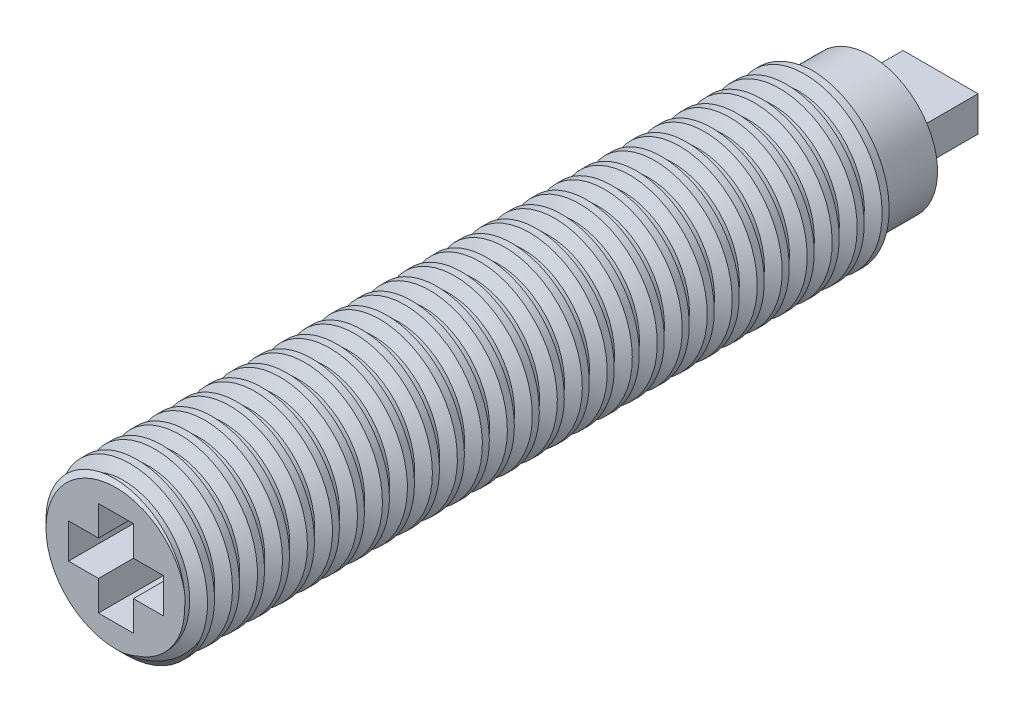
from build123d import *

# Parameters (mm, degrees)
SKETCH1_R           = 8
BOSS_EXTRUDE1_DEPTH = 75.5
CHAMFER1_SIZE       = 1
CUT_SWEEP2_PITCH    = 2.5
SKETCH5_W           = 1.3
SKETCH5_H           = 5.5
SKETCH6_W           = 7.5
SKETCH6_H           = 3.5
BOSS_EXTRUDE2_DEPTH = 7
CUT_EXTRUDE1_DEPTH  = 1.5
SKETCH8_W           = 3.5
SKETCH8_H           = 3
SKETCH8_H_2         = 3.5
SKETCH8_W_2         = 3
CUT_EXTRUDE2_DEPTH  = 11


with BuildPart() as part:
    # Sketch1 → Boss-Extrude1 (new body)
    with BuildSketch(Plane.XY):
        Circle(SKETCH1_R)
    extrude(amount=BOSS_EXTRUDE1_DEPTH)

    # Chamfer1
    chamfer1_edges = [part.edges().sort_by_distance(p)[0] for p in [
        (-8, 0, 75.5),
    ]]
    chamfer(chamfer1_edges, length=CHAMFER1_SIZE)

    # Cut-Sweep2: the profile of Sketch4 screwed along a left-hand helix of 29 turns, 10 arcs to a turn; built about Z, then put on its axis
    cut_sweep2_z = Axis((0, 0, 0), (0, 0, 1))
    cut_sweep2_corners = [(8.170091408, 0, 0), (8.170091408, 0, -2), (6.870091408, 0, -1.24944465), (6.870091408, 0, -0.75055535)]
    with BuildLine(mode=Mode.PRIVATE) as cut_sweep2_profile:
        Line(cut_sweep2_corners[0], cut_sweep2_corners[1])
        Line(cut_sweep2_corners[1], cut_sweep2_corners[2])
        Line(cut_sweep2_corners[2], cut_sweep2_corners[3])
        Line(cut_sweep2_corners[3], cut_sweep2_corners[0])
    cut_sweep2_cap = Face(cut_sweep2_profile.wire())
    cut_sweep2_turn_angles = [0, -18, -36, -54, -72, -90, -108, -126, -144, -162, -180, -198, -216, -234, -252, -270, -288, -306, -324, -342, -360]
    cut_sweep2_turn_weights = [1, 0.9510565162951535, 1, 0.9510565162951535, 1, 0.9510565162951535, 1, 0.9510565162951535, 1, 0.9510565162951535, 1, 0.9510565162951535, 1, 0.9510565162951535, 1, 0.9510565162951535, 1, 0.9510565162951535, 1, 0.9510565162951535, 1]
    cut_sweep2_turn_rails = [Edge.make_bspline([Vector(p[0], p[1], 0).rotate(cut_sweep2_z, cut_sweep2_turn_angles[k]) / cut_sweep2_turn_weights[k] + Vector(0, 0, p[2] + -CUT_SWEEP2_PITCH * cut_sweep2_turn_angles[k] / 360) for k in range(21)], [0, 0, 0, 1, 1, 2, 2, 3, 3, 4, 4, 5, 5, 6, 6, 7, 7, 8, 8, 9, 9, 10, 10, 10], 2, cut_sweep2_turn_weights) for p in cut_sweep2_corners]
    cut_sweep2_turn_sides = [Face.make_surface_from_curves(cut_sweep2_turn_rails[p[0]], cut_sweep2_turn_rails[p[1]]) for p in [(0, 1), (1, 2), (2, 3), (3, 0)]]
    cut_sweep2 = Plane(origin=(0, 0, 75.5), x_dir=(-1, 0, 0), z_dir=(0, 0, -1)) * Solid(Shell([*[p.moved(Location((0, 0, CUT_SWEEP2_PITCH * i))) for i in range(29) for p in cut_sweep2_turn_sides], cut_sweep2_cap, cut_sweep2_cap.rotate(cut_sweep2_z, -10440).moved(Location((0, 0, -CUT_SWEEP2_PITCH * -10440 / 360)))]))
    add(cut_sweep2, mode=Mode.SUBTRACT)

    # Cut-Sweep3: sweep along a curve in space
    with BuildLine() as cut_sweep3_path:
        ThreePointArc((8, 0, 0), (5.656854249, 5.656854249, 0), (0, 8, 0))
        ThreePointArc((0, 8, 0), (-5.656854249, 5.656854249, 0), (-8, 0, 0))
        ThreePointArc((-8, 0, 0), (-5.656854249, -5.656854249, 0), (0, -8, 0))
        ThreePointArc((0, -8, 0), (5.656854249, -5.656854249, 0), (8, 0, 0))
    # Sketch5 → Cut-Sweep3 (sweep, cut)
    with BuildSketch(Plane(origin=(0, 0, 0), x_dir=(1, 0, 0), z_dir=(0, 1, 0))):
        with Locations((7.35, -2.75)):
            Rectangle(SKETCH5_W, SKETCH5_H)
    sweep(path=cut_sweep3_path.line, mode=Mode.SUBTRACT)

    # Sketch6 → Boss-Extrude2 (add)
    with BuildSketch(Plane.XY):
        Rectangle(SKETCH6_W, SKETCH6_H)
    extrude(amount=-BOSS_EXTRUDE2_DEPTH)

    # Sketch7 → Cut-Extrude1 (cut)
    with BuildSketch(Plane.XY):
        with BuildLine():
            Line((1.997706693, 4.551919587), (2.326733136, 4.237416382))
            add(Edge.make_bspline(
                [(2.326733136, 4.237416382), (2.354643839, 4.266276096), (2.409162187, 4.322648159), (2.497011762, 4.397279802), (2.588372121, 4.459475179), (2.681466031, 4.51185573), (2.777967982, 4.551485349), (2.876762148, 4.58036412), (2.978479359, 4.597970416), (3.047317655, 4.599984888), (3.081941469, 4.600998113)],
                knots=[0, 0, 0, 0, 1.115251505, 2.178435587, 3.19620269, 4.182487026, 5.141301733, 6.088180966, 7.038406374, 8, 8, 8, 8], degree=3))
            add(Edge.make_bspline(
                [(3.081941469, 4.600998113), (3.110856561, 4.600197629), (3.16791731, 4.598617964), (3.251697442, 4.587037456), (3.331837468, 4.5673443), (3.408611721, 4.540203482), (3.481794288, 4.505084705), (3.551538605, 4.462015148), (3.617672722, 4.411383792), (3.679323045, 4.353452606), (3.735718594, 4.290158431), (3.785547652, 4.222623698), (3.827287481, 4.151003124), (3.86154268, 4.076022031), (3.888226156, 3.997333368), (3.90728151, 3.914990111), (3.918302618, 3.828894197), (3.919947592, 3.770366837), (3.920783616, 3.74062151)],
                knots=[0, 0, 0, 0, 1.035432265, 2.043311493, 3.022114605, 3.98653278, 4.95457646, 5.923598177, 6.917315552, 7.932509744, 8.948865224, 9.949768934, 10.933144597, 11.912367597, 12.897413939, 13.903909035, 14.934704909, 16, 16, 16, 16], degree=3))
            add(Edge.make_bspline(
                [(3.920783616, 3.74062151), (3.920542684, 3.719744159), (3.9200678, 3.67859447), (3.914869364, 3.617722661), (3.906498655, 3.558662614), (3.894384165, 3.501503792), (3.879234877, 3.446196658), (3.861461313, 3.392264083), (3.839164637, 3.340451292), (3.814414991, 3.290156513), (3.785631438, 3.242752102), (3.754597458, 3.197548063), (3.720946173, 3.15476598), (3.684459623, 3.114580748), (3.644624304, 3.077620372), (3.602469811, 3.04277341), (3.557285058, 3.010912199), (3.510008646, 2.981237147), (3.460232166, 2.955458177), (3.40930617, 2.932107411), (3.356458516, 2.913143117), (3.302332658, 2.897856165), (3.247122021, 2.884856897), (3.190286594, 2.876852847), (3.13231907, 2.870791474), (3.093142753, 2.87041722), (3.073427847, 2.870228882)],
                knots=[0, 0, 0, 0, 1.103660481, 2.175337485, 3.227646561, 4.255952547, 5.262355991, 6.258840057, 7.255597736, 8.242457506, 9.22035537, 10.185017736, 11.140346927, 12.096287581, 13.051739095, 14.01125915, 14.986044842, 15.97314143, 16.960198552, 17.947847494, 18.933482797, 19.925264591, 20.920966487, 21.929612487, 22.958107872, 24, 24, 24, 24], degree=3))
            add(Edge.make_bspline(
                [(3.073427847, 2.870228882), (3.039987978, 2.87119614), (2.97428733, 2.873096552), (2.877862183, 2.8879575), (2.785978625, 2.912402918), (2.712564101, 2.941271536), (2.655045761, 2.969779672), (2.611257899, 2.996148294), (2.565977837, 3.025644492), (2.519957637, 3.059381486), (2.472679665, 3.096954417), (2.424978485, 3.139186203), (2.375632939, 3.184686213), (2.343307161, 3.217160463), (2.326733136, 3.233810613)],
                knots=[0, 0, 0, 0, 1.404581149, 2.759636711, 4.088442092, 5.392261763, 6.066678138, 6.783632037, 7.538459478, 8.336747902, 9.180226004, 10.074962426, 11.012997595, 12, 12, 12, 12], degree=3))
            Line((2.326733136, 3.233810613), (2.007722719, 2.898774555))
            add(Edge.make_bspline(
                [(2.007722719, 2.898774555), (2.030147434, 2.877124197), (2.073915682, 2.834867327), (2.13993887, 2.774866515), (2.205878965, 2.720949115), (2.270142992, 2.671158163), (2.333783662, 2.626944189), (2.396794227, 2.588263037), (2.45846138, 2.554136403), (2.520065658, 2.525139818), (2.581990396, 2.500518705), (2.645703674, 2.479321544), (2.711400269, 2.461389507), (2.779481427, 2.446920709), (2.849312129, 2.435318686), (2.921545895, 2.427487388), (2.99572473, 2.422222666), (3.046041383, 2.421749587), (3.071424642, 2.421510933)],
                knots=[0, 0, 0, 0, 1.244526981, 2.429050516, 3.560637417, 4.644440555, 5.67424972, 6.652764056, 7.595344123, 8.486817594, 9.369275933, 10.254498637, 11.166417451, 12.086725134, 13.032340136, 13.991389299, 14.986715468, 16, 16, 16, 16], degree=3))
            add(Edge.make_bspline(
                [(3.071424642, 2.421510933), (3.118050545, 2.42269952), (3.209284476, 2.425025255), (3.342985424, 2.442257376), (3.469997735, 2.471146723), (3.590630407, 2.512004227), (3.704845081, 2.564197774), (3.812612539, 2.628184612), (3.913759082, 2.703794738), (4.007467645, 2.790141928), (4.092231501, 2.88550515), (4.167152933, 2.987899089), (4.229127945, 3.097826973), (4.280587132, 3.213664816), (4.32082754, 3.335941231), (4.349149965, 3.464788485), (4.366616198, 3.600082166), (4.368527029, 3.692490869), (4.369501565, 3.739619908)],
                knots=[0, 0, 0, 0, 1.078019885, 2.10938526, 3.111377082, 4.085535484, 5.04941344, 6.010039228, 6.978205633, 7.964457913, 8.951525778, 9.924444315, 10.892603023, 11.863865945, 12.85144698, 13.863884204, 14.910567087, 16, 16, 16, 16], degree=3))
            add(Edge.make_bspline(
                [(4.369501565, 3.739619908), (4.369089773, 3.770357064), (4.368273703, 3.831270596), (4.359696726, 3.921001164), (4.347739922, 4.008472417), (4.328771539, 4.092776114), (4.305907025, 4.175047981), (4.277471997, 4.254393819), (4.24351187, 4.331041677), (4.20512126, 4.405119867), (4.161690347, 4.476143097), (4.113173249, 4.543501167), (4.060818985, 4.607714068), (4.003369569, 4.667929896), (3.941659814, 4.72467736), (3.87541111, 4.777648932), (3.805021908, 4.827604285), (3.730301691, 4.873255192), (3.652702075, 4.914548865), (3.573201794, 4.950971647), (3.491996171, 4.981412705), (3.409428551, 5.006662441), (3.325150086, 5.025509583), (3.239762336, 5.039776261), (3.152538753, 5.047751425), (3.093975674, 5.049057011), (3.064413424, 5.049716061)],
                knots=[0, 0, 0, 0, 1.071919942, 2.124283339, 3.142214191, 4.149696895, 5.136002878, 6.119640489, 7.086990633, 8.058538607, 9.028339693, 9.988281803, 10.952401235, 11.916291999, 12.888973767, 13.874849856, 14.873389453, 15.898127285, 16.927174885, 17.938320013, 18.946391617, 19.950418109, 20.947802303, 21.956882652, 22.968648068, 24, 24, 24, 24], degree=3))
            add(Edge.make_bspline(
                [(3.064413424, 5.049716061), (3.039193794, 5.049338277), (2.989016747, 5.048586636), (2.914294705, 5.042320893), (2.840170255, 5.032480607), (2.766908785, 5.01763371), (2.693986254, 5.000008568), (2.622360947, 4.976930875), (2.550902934, 4.951206438), (2.480732929, 4.920458125), (2.411752985, 4.886893565), (2.345579066, 4.848813352), (2.281100117, 4.808560901), (2.219744954, 4.763753895), (2.160364262, 4.716017567), (2.103268548, 4.665129201), (2.04895886, 4.610240338), (2.014877116, 4.571458116), (1.997706693, 4.551919587)],
                knots=[0, 0, 0, 0, 0.996412454, 1.982464992, 2.961075852, 3.949442424, 4.934965278, 5.923860011, 6.921385422, 7.934793307, 8.949617135, 9.951082467, 10.950285876, 11.951772932, 12.951063433, 13.960125323, 14.972308753, 16, 16, 16, 16], degree=3))
        make_face()
        with BuildLine():
            Line((-0.694600999, 4.551919587), (-0.365574557, 4.237416382))
            add(Edge.make_bspline(
                [(-0.365574557, 4.237416382), (-0.337663853, 4.266276096), (-0.283145506, 4.322648159), (-0.195295931, 4.397279802), (-0.103935571, 4.459475179), (-0.010841661, 4.51185573), (0.08566029, 4.551485349), (0.184454456, 4.58036412), (0.286171667, 4.597970416), (0.355009963, 4.599984888), (0.389633777, 4.600998113)],
                knots=[0, 0, 0, 0, 1.115251505, 2.178435587, 3.19620269, 4.182487026, 5.141301733, 6.088180966, 7.038406374, 8, 8, 8, 8], degree=3))
            add(Edge.make_bspline(
                [(0.389633777, 4.600998113), (0.418548869, 4.600197629), (0.475609618, 4.598617964), (0.55938975, 4.587037456), (0.639529776, 4.5673443), (0.716304028, 4.540203482), (0.789486595, 4.505084705), (0.859230913, 4.462015148), (0.92536503, 4.411383792), (0.987015353, 4.353452606), (1.043410902, 4.290158431), (1.09323996, 4.222623698), (1.134979789, 4.151003124), (1.169234988, 4.076022031), (1.195918464, 3.997333368), (1.214973818, 3.914990111), (1.225994926, 3.828894197), (1.2276399, 3.770366837), (1.228475924, 3.74062151)],
                knots=[0, 0, 0, 0, 1.035432265, 2.043311493, 3.022114605, 3.98653278, 4.95457646, 5.923598177, 6.917315552, 7.932509744, 8.948865224, 9.949768934, 10.933144597, 11.912367597, 12.897413939, 13.903909035, 14.934704909, 16, 16, 16, 16], degree=3))
            add(Edge.make_bspline(
                [(1.228475924, 3.74062151), (1.228234991, 3.719744159), (1.227760108, 3.67859447), (1.222561671, 3.617722661), (1.214190963, 3.558662614), (1.202076473, 3.501503792), (1.186927185, 3.446196658), (1.16915362, 3.392264083), (1.146856945, 3.340451292), (1.122107299, 3.290156513), (1.093323746, 3.242752102), (1.062289766, 3.197548063), (1.028638481, 3.15476598), (0.99215193, 3.114580748), (0.952316611, 3.077620372), (0.910162119, 3.04277341), (0.864977366, 3.010912199), (0.817700954, 2.981237147), (0.767924474, 2.955458177), (0.716998477, 2.932107411), (0.664150824, 2.913143117), (0.610024965, 2.897856165), (0.554814329, 2.884856897), (0.497978902, 2.876852847), (0.440011378, 2.870791474), (0.400835061, 2.87041722), (0.381120155, 2.870228882)],
                knots=[0, 0, 0, 0, 1.103660481, 2.175337485, 3.227646561, 4.255952547, 5.262355991, 6.258840057, 7.255597736, 8.242457506, 9.22035537, 10.185017736, 11.140346927, 12.096287581, 13.051739095, 14.01125915, 14.986044842, 15.97314143, 16.960198552, 17.947847494, 18.933482797, 19.925264591, 20.920966487, 21.929612487, 22.958107872, 24, 24, 24, 24], degree=3))
            add(Edge.make_bspline(
                [(0.381120155, 2.870228882), (0.347680286, 2.87119614), (0.281979638, 2.873096552), (0.185554491, 2.8879575), (0.093670932, 2.912402918), (0.020256409, 2.941271536), (-0.037261931, 2.969779672), (-0.081049794, 2.996148294), (-0.126329856, 3.025644492), (-0.172350055, 3.059381486), (-0.219628027, 3.096954417), (-0.267329207, 3.139186203), (-0.316674753, 3.184686213), (-0.349000532, 3.217160463), (-0.365574557, 3.233810613)],
                knots=[0, 0, 0, 0, 1.404581149, 2.759636711, 4.088442092, 5.392261763, 6.066678138, 6.783632037, 7.538459478, 8.336747902, 9.180226004, 10.074962426, 11.012997595, 12, 12, 12, 12], degree=3))
            Line((-0.365574557, 3.233810613), (-0.684584973, 2.898774555))
            add(Edge.make_bspline(
                [(-0.684584973, 2.898774555), (-0.662160258, 2.877124197), (-0.61839201, 2.834867327), (-0.552368822, 2.774866515), (-0.486428727, 2.720949115), (-0.422164701, 2.671158163), (-0.35852403, 2.626944189), (-0.295513465, 2.588263037), (-0.233846313, 2.554136403), (-0.172242034, 2.525139818), (-0.110317297, 2.500518705), (-0.046604019, 2.479321544), (0.019092577, 2.461389507), (0.087173735, 2.446920709), (0.157004436, 2.435318686), (0.229238203, 2.427487388), (0.303417038, 2.422222666), (0.35373369, 2.421749587), (0.37911695, 2.421510933)],
                knots=[0, 0, 0, 0, 1.244526981, 2.429050516, 3.560637417, 4.644440555, 5.67424972, 6.652764056, 7.595344123, 8.486817594, 9.369275933, 10.254498637, 11.166417451, 12.086725134, 13.032340136, 13.991389299, 14.986715468, 16, 16, 16, 16], degree=3))
            add(Edge.make_bspline(
                [(0.37911695, 2.421510933), (0.425742852, 2.42269952), (0.516976784, 2.425025255), (0.650677731, 2.442257376), (0.777690043, 2.471146723), (0.898322715, 2.512004227), (1.012537389, 2.564197774), (1.120304847, 2.628184612), (1.221451389, 2.703794738), (1.315159953, 2.790141928), (1.399923809, 2.88550515), (1.474845241, 2.987899089), (1.536820252, 3.097826973), (1.58827944, 3.213664816), (1.628519848, 3.335941231), (1.656842273, 3.464788485), (1.674308506, 3.600082166), (1.676219337, 3.692490869), (1.677193873, 3.739619908)],
                knots=[0, 0, 0, 0, 1.078019885, 2.10938526, 3.111377082, 4.085535484, 5.04941344, 6.010039228, 6.978205633, 7.964457913, 8.951525778, 9.924444315, 10.892603023, 11.863865945, 12.85144698, 13.863884204, 14.910567087, 16, 16, 16, 16], degree=3))
            add(Edge.make_bspline(
                [(1.677193873, 3.739619908), (1.676782081, 3.770357064), (1.67596601, 3.831270596), (1.667389034, 3.921001164), (1.65543223, 4.008472417), (1.636463847, 4.092776114), (1.613599332, 4.175047981), (1.585164305, 4.254393819), (1.551204178, 4.331041677), (1.512813568, 4.405119867), (1.469382654, 4.476143097), (1.420865556, 4.543501167), (1.368511293, 4.607714068), (1.311061876, 4.667929896), (1.249352122, 4.72467736), (1.183103418, 4.777648932), (1.112714216, 4.827604285), (1.037993999, 4.873255192), (0.960394383, 4.914548865), (0.880894101, 4.950971647), (0.799688478, 4.981412705), (0.717120858, 5.006662441), (0.632842394, 5.025509583), (0.547454644, 5.039776261), (0.460231061, 5.047751425), (0.401667981, 5.049057011), (0.372105732, 5.049716061)],
                knots=[0, 0, 0, 0, 1.071919942, 2.124283339, 3.142214191, 4.149696895, 5.136002878, 6.119640489, 7.086990633, 8.058538607, 9.028339693, 9.988281803, 10.952401235, 11.916291999, 12.888973767, 13.874849856, 14.873389453, 15.898127285, 16.927174885, 17.938320013, 18.946391617, 19.950418109, 20.947802303, 21.956882652, 22.968648068, 24, 24, 24, 24], degree=3))
            add(Edge.make_bspline(
                [(0.372105732, 5.049716061), (0.346886101, 5.049338277), (0.296709055, 5.048586636), (0.221987013, 5.042320893), (0.147862563, 5.032480607), (0.074601093, 5.01763371), (0.001678562, 5.000008568), (-0.069946746, 4.976930875), (-0.141404758, 4.951206438), (-0.211574763, 4.920458125), (-0.280554707, 4.886893565), (-0.346728626, 4.848813352), (-0.411207575, 4.808560901), (-0.472562738, 4.763753895), (-0.53194343, 4.716017567), (-0.589039144, 4.665129201), (-0.643348832, 4.610240338), (-0.677430576, 4.571458116), (-0.694600999, 4.551919587)],
                knots=[0, 0, 0, 0, 0.996412454, 1.982464992, 2.961075852, 3.949442424, 4.934965278, 5.923860011, 6.921385422, 7.934793307, 8.949617135, 9.951082467, 10.950285876, 11.951772932, 12.951063433, 13.960125323, 14.972308753, 16, 16, 16, 16], degree=3))
        make_face()
        Polygon((-0.902934332, 4.985613497), (-1.366175518, 4.985613497), (-1.736267666, 3.389559811), (-2.160446352, 4.985613497), (-2.596644268, 4.985613497), (-3.018318948, 3.389559811), (-3.387409493, 4.985613497), (-3.851652281, 4.985613497), (-3.2732268, 2.485613497), (-2.8044768, 2.485613497), (-2.377293307, 4.101699235), (-1.947605807, 2.485613497), (-1.482361416, 2.485613497), align=None)
    extrude(amount=CUT_EXTRUDE1_DEPTH, mode=Mode.SUBTRACT)

    # Sketch8 → Cut-Extrude2 (cut)
    with BuildSketch(Plane.XY.offset(75.5)):
        with Locations((0, 3.25)):
            Rectangle(SKETCH8_W, SKETCH8_H)
        Rectangle(SKETCH8_W, SKETCH8_H_2)
        with Locations((3.25, 0)):
            Rectangle(SKETCH8_W_2, SKETCH8_H_2)
        with Locations((-3.25, 0)):
            Rectangle(SKETCH8_W_2, SKETCH8_H_2)
        with Locations((0, -3.25)):
            Rectangle(SKETCH8_W, SKETCH8_H)
    extrude(amount=-CUT_EXTRUDE2_DEPTH, mode=Mode.SUBTRACT)


solid = part.part
